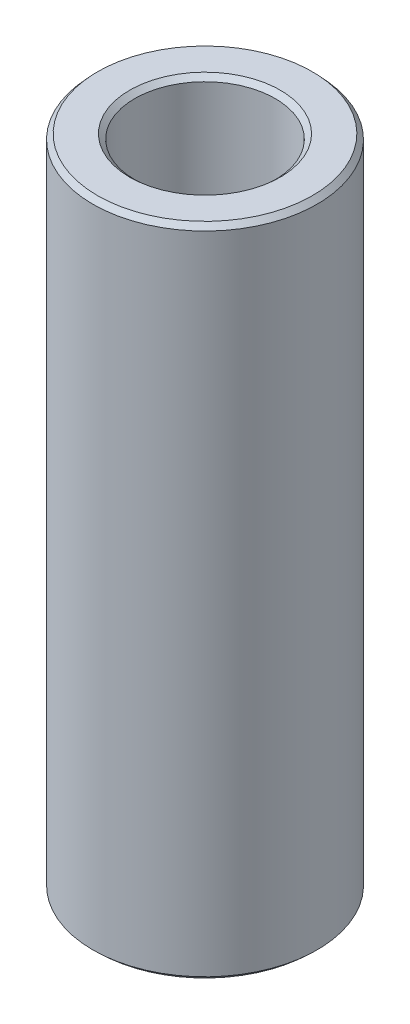
from build123d import *
from OCP.BRepFilletAPI import BRepFilletAPI_MakeChamfer

# Parameters (mm, degrees)
SKETCH1_R           = 20
BOSS_EXTRUDE1_DEPTH = 116.987835012
SKETCH2_R           = 12.538774002
CUT_EXTRUDE1_DEPTH  = 121.358437763
CHAMFER1_SIZE       = 0.90969194
CHAMFER1_SIZE2      = 0.83651402


with BuildPart() as part:
    # Sketch1 → Boss-Extrude1 (new body)
    with BuildSketch(Plane(origin=(0, 0, 0), x_dir=(1, 0, 0), z_dir=(0, 1, 0))):
        Circle(SKETCH1_R)
    extrude(amount=BOSS_EXTRUDE1_DEPTH)

    # Sketch2 → Cut-Extrude1 (cut, through all)
    with BuildSketch(Plane(origin=(0, 0, 0), x_dir=(1, 0, 0), z_dir=(0, 1, 0))):
        Circle(SKETCH2_R)
    extrude(amount=CUT_EXTRUDE1_DEPTH, mode=Mode.SUBTRACT)

    # Chamfer1: one chamfer whose edges measure the first distance from different faces: ONE call of the kernel's chamfer builder (chamfer() names one face for all edges)
    chamfer1_edges_1 = [part.edges().sort_by_distance(p)[0] for p in [
        (-12.538774002, 116.987835012, 0),
    ]]
    chamfer1_side_1 = [part.faces().sort_by_distance(p)[0] for p in [
        (-19.434314575, 116.987835012, 0),
    ]]
    chamfer1_edges_2 = [part.edges().sort_by_distance(p)[0] for p in [
        (-12.538774002, 0, 0),
    ]]
    chamfer1_side_2 = [part.faces().sort_by_distance(p)[0] for p in [
        (-12.538774002, 58.493917506, 0),
    ]]
    chamfer1_edges_3 = [part.edges().sort_by_distance(p)[0] for p in [
        (-20, 0, 0),
    ]]
    chamfer1_side_3 = [part.faces().sort_by_distance(p)[0] for p in [
        (-19.434314575, 0, 0),
    ]]
    chamfer1_edges_4 = [part.edges().sort_by_distance(p)[0] for p in [
        (-20, 116.987835012, 0),
    ]]
    chamfer1_side_4 = [part.faces().sort_by_distance(p)[0] for p in [
        (-20, 58.493917506, 0),
    ]]
    chamfer1 = BRepFilletAPI_MakeChamfer(part.part.solid().wrapped)
    for e in chamfer1_edges_1:
        chamfer1.Add(CHAMFER1_SIZE, CHAMFER1_SIZE2, e.wrapped, chamfer1_side_1[0].wrapped)  # the first distance lies on this face
    for e in chamfer1_edges_2:
        chamfer1.Add(CHAMFER1_SIZE, CHAMFER1_SIZE2, e.wrapped, chamfer1_side_2[0].wrapped)  # the first distance lies on this face
    for e in chamfer1_edges_3:
        chamfer1.Add(CHAMFER1_SIZE, CHAMFER1_SIZE2, e.wrapped, chamfer1_side_3[0].wrapped)  # the first distance lies on this face
    for e in chamfer1_edges_4:
        chamfer1.Add(CHAMFER1_SIZE, CHAMFER1_SIZE2, e.wrapped, chamfer1_side_4[0].wrapped)  # the first distance lies on this face
    add(Compound.cast(chamfer1.Shape()), mode=Mode.REPLACE)


solid = part.part
